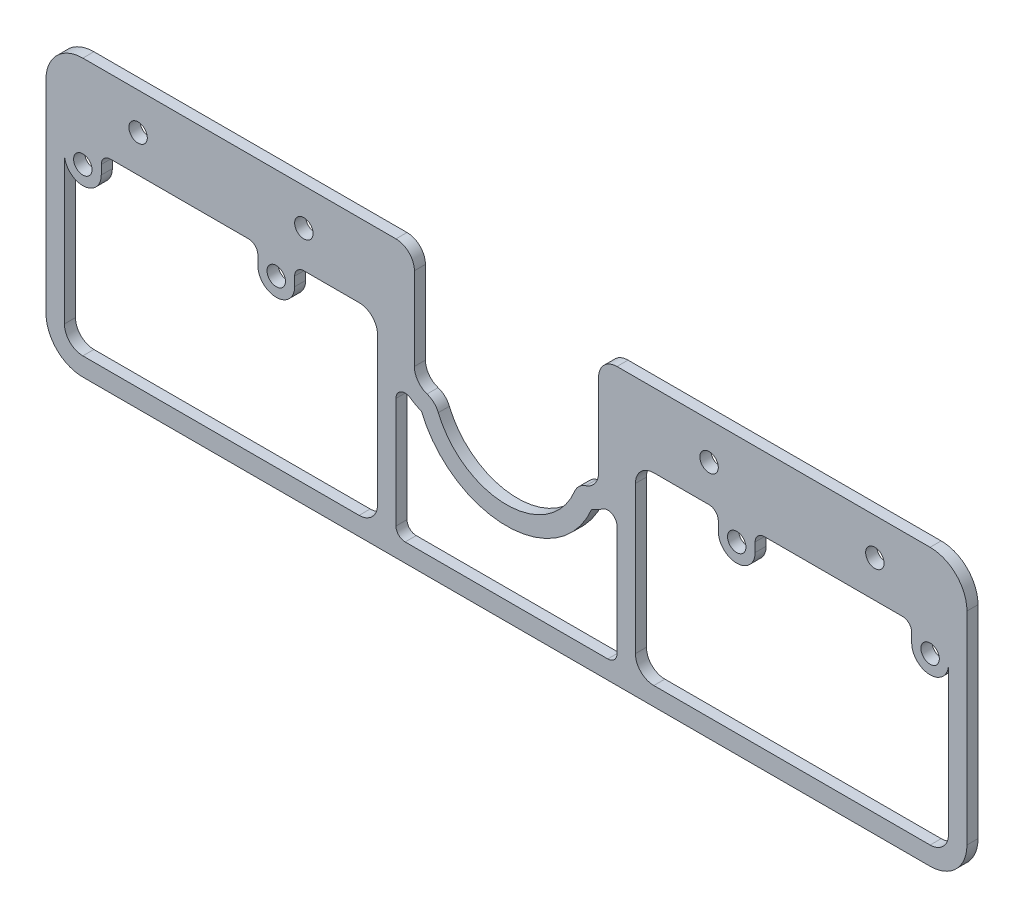
from build123d import *

# Parameters (mm, degrees)
BOSS_EXTRUDE1_DEPTH = 6
SKETCH3_R           = 5
CUT_EXTRUDE1_DEPTH  = 262.076617107
SKETCH4_R           = 5
CUT_EXTRUDE2_DEPTH  = 262.076617107
CUT_EXTRUDE5_DEPTH  = 262.076617107
FILLET5_R           = 5
FILLET6_R           = 5


with BuildPart() as part:
    # Sketch1 → Boss-Extrude1 (new body)
    with BuildSketch(Plane.XY):
        with BuildLine():
            Line((-250, -55), (-250, 3.178280867))
            Line((-250, 3.178280867), (-250, 55))
            ThreePointArc((-250, 55), (-244.142135624, 69.142135624), (-230, 75))
            Line((-230, 75), (-220, 75))
            Line((-220, 75), (-164.330865428, 75))
            Line((-164.330865428, 75), (-60, 75))
            ThreePointArc((-60, 75), (-52.928932188, 72.071067812), (-50, 65))
            Line((-50, 65), (-50, 20))
            ThreePointArc((-50, 20), (-48.100925873, 14.1369803), (-43.125, 10.500822404))
            ThreePointArc((-43.125, 10.500822404), (-39.437786703, 8.32242004), (-37, 4.801315846))
            ThreePointArc((-37, 4.801315846), (-22.271648276, -13.226099426), (0, -20))
            Line((0, -20), (0, -40))
            Line((0, -40), (0, -65))
            Line((0, -65), (0, -75))
            Line((0, -75), (-230, -75))
            ThreePointArc((-230, -75), (-244.142135624, -69.142135624), (-250, -55))
        make_face()
    boss_extrude1 = extrude(amount=BOSS_EXTRUDE1_DEPTH)

    # Mirror1: Boss-Extrude1 across plane
    add(boss_extrude1.mirror(Plane(origin=(0, -20, 6), x_dir=(0, 0, 1), z_dir=(-1, 0, 0))))

    # Sketch3 → Cut-Extrude1 (cut, through all)
    with BuildSketch(Plane.XY.offset(6)):
        with Locations((110, 55)):
            Circle(SKETCH3_R)
        with Locations((200, 55)):
            Circle(SKETCH3_R)
        with Locations((-200, 55)):
            Circle(SKETCH3_R)
        with Locations((-110, 55)):
            Circle(SKETCH3_R)
    extrude(amount=-CUT_EXTRUDE1_DEPTH, mode=Mode.SUBTRACT)

    # Sketch4 → Cut-Extrude2 (cut, through all)
    with BuildSketch(Plane.XY.offset(6)):
        with BuildLine():
            Line((-70, -55), (-70, 25))
            ThreePointArc((-70, 25), (-72.928932188, 32.071067812), (-80, 35))
            Line((-80, 35), (-110, 35))
            ThreePointArc((-110, 35), (-113.535533906, 33.535533906), (-115, 30))
            Line((-115, 30), (-115, 25))
            ThreePointArc((-115, 25), (-125, 15), (-135, 25))
            Line((-135, 25), (-135, 30))
            ThreePointArc((-135, 30), (-136.464466094, 33.535533906), (-140, 35))
            Line((-140, 35), (-215, 35))
            ThreePointArc((-215, 35), (-218.535533906, 33.535533906), (-220, 30))
            Line((-220, 30), (-220, 25))
            ThreePointArc((-220, 25), (-230, 15), (-240, 25))
            Line((-240, 25), (-240, -55))
            ThreePointArc((-240, -55), (-237.071067812, -62.071067812), (-230, -65))
            Line((-230, -65), (-80, -65))
            ThreePointArc((-80, -65), (-72.928932188, -62.071067812), (-70, -55))
        make_face()
        with Locations((-230, 25)):
            Circle(SKETCH4_R)
        with Locations((-125, 25)):
            Circle(SKETCH4_R)
    cut_extrude2 = extrude(amount=-CUT_EXTRUDE2_DEPTH, mode=Mode.SUBTRACT)

    # Sketch8 → Cut-Extrude5 (cut, through all)
    with BuildSketch(Plane.XY.offset(6)):
        with BuildLine():
            Line((-60, 0), (-60, -65))
            Line((-60, -65), (60, -65))
            Line((60, -65), (60, 0))
            ThreePointArc((60, 0), (57.236067977, 4.472135955), (52, 4))
            ThreePointArc((52, 4), (49.247332505, 2.266223145), (46.25, 1.001644808))
            ThreePointArc((46.25, 1.001644808), (0, -30), (-46.25, 1.001644808))
            ThreePointArc((-46.25, 1.001644808), (-49.247332505, 2.266223145), (-52, 4))
            ThreePointArc((-52, 4), (-57.236067977, 4.472135955), (-60, 0))
        make_face()
    extrude(amount=-CUT_EXTRUDE5_DEPTH, mode=Mode.SUBTRACT)

    # Fillet5
    fillet5_edges = [part.edges().sort_by_distance(p)[0] for p in [
        (-60, -65, 3),
    ]]
    fillet(fillet5_edges, radius=FILLET5_R)

    # Fillet6
    fillet6_edges = [part.edges().sort_by_distance(p)[0] for p in [
        (60, -65, 3),
    ]]
    fillet(fillet6_edges, radius=FILLET6_R)

    # Mirror2: Cut-Extrude2 across plane
    add(cut_extrude2.mirror(Plane(origin=(0, 0, 0), x_dir=(0, 0, 1), z_dir=(1, 0, 0))), mode=Mode.SUBTRACT)


solid = part.part
